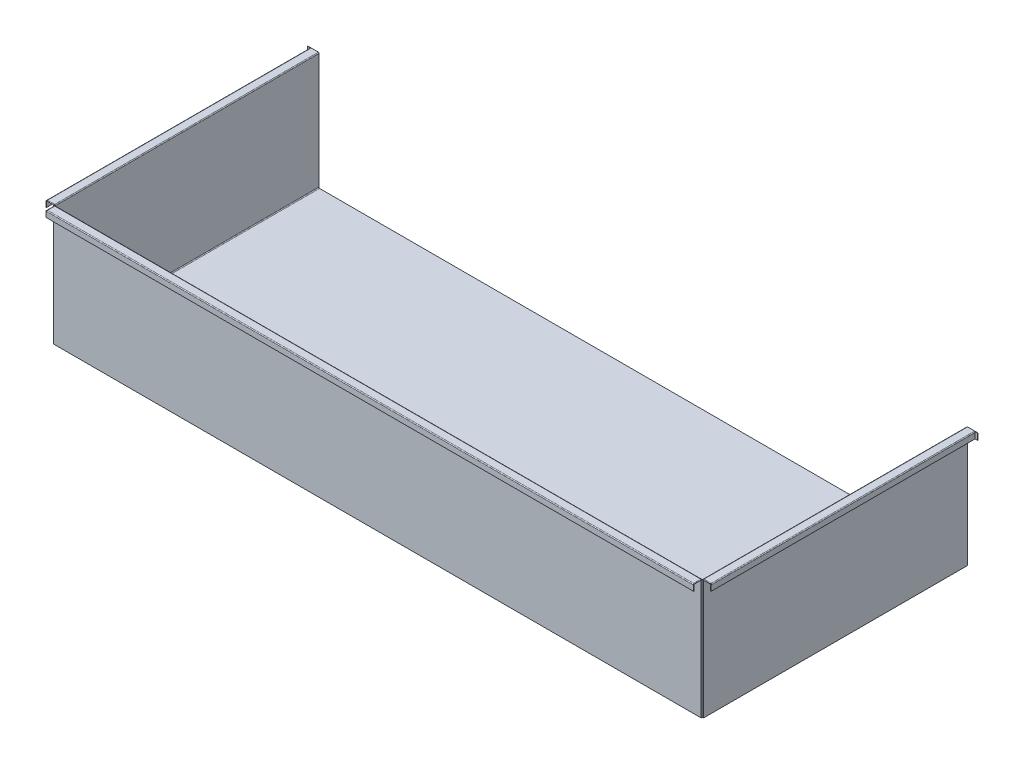
from build123d import *

# Parameters (mm, degrees)
BOSS_EXTRUDE1_DEPTH = 336.55
SKETCH2_W           = 14.2875
SKETCH2_H           = 7.9375
BOSS_EXTRUDE2_DEPTH = 0.508
BOSS_EXTRUDE6_DEPTH = 412.7627
FILLET1_R           = 1.016
FILLET2_R           = 1.016
FILLET3_R           = 1.016
FILLET4_R           = 1.016
FILLET5_R           = 1.016


with BuildPart() as part:
    # Sketch1 → Boss-Extrude1 (new body)
    with BuildSketch(Plane.XY):
        Polygon((-412.75, 0), (412.75, 0), (412.75, 149.225), (423.8625, 149.225), (423.8625, 141.2875), (423.3545, 141.2875), (423.3545, 148.717), (414.3375, 148.717), (414.3375, -3.175), (-414.3375, -3.175), (-414.3375, 148.717), (-423.3545, 148.717), (-423.3545, 141.2875), (-423.8625, 141.2875), (-423.8625, 149.225), (-412.75, 149.225), align=None)
    extrude(amount=BOSS_EXTRUDE1_DEPTH)

    # Sketch2 → Boss-Extrude2 (add)
    with BuildSketch(Plane(origin=(0, 0, 0), x_dir=(-1, 0, 0), z_dir=(0, 0, -1))):
        with Locations((-419.89375, 145.25625)):
            Rectangle(SKETCH2_W, SKETCH2_H)
        with Locations((419.89375, 145.25625)):
            Rectangle(SKETCH2_W, SKETCH2_H)
    extrude(amount=BOSS_EXTRUDE2_DEPTH)

    # Sketch3 → Boss-Extrude6 (add, symmetric)
    with BuildSketch(Plane(origin=(0, 0, 0), x_dir=(0, 0, -1), z_dir=(1, 0, 0))):
        Polygon((-336.55, -3.175), (-336.55, 149.225), (-347.6625, 149.225), (-347.6625, 141.2875), (-347.1545, 141.2875), (-347.1545, 148.717), (-338.1375, 148.717), (-338.1375, -3.175), align=None)
    extrude(amount=BOSS_EXTRUDE6_DEPTH, both=True)

    # Fillet1
    fillet1_edges = [part.edges().sort_by_distance(p)[0] for p in [
        (412.75, 74.6125, 336.55),
    ]]
    fillet(fillet1_edges, radius=FILLET1_R)

    # Fillet2
    fillet2_edges = [part.edges().sort_by_distance(p)[0] for p in [
        (412.7627, 73.025, 336.55),
    ]]
    fillet(fillet2_edges, radius=FILLET2_R)

    # Fillet3
    fillet3_edges = [part.edges().sort_by_distance(p)[0] for p in [
        (-412.75, 74.6125, 336.55),
        (-412.7627, 73.025, 336.55),
    ]]
    fillet(fillet3_edges, radius=FILLET3_R)

    # Fillet4
    fillet4_edges = [part.edges().sort_by_distance(p)[0] for p in [
        (0, 0, 336.55),
        (412.75, 0, 167.767),
        (412.45242049, 0, 336.25242049),
        (-412.75, 0, 167.767),
        (-412.45242049, 0, 336.25242049),
    ]]
    fillet(fillet4_edges, radius=FILLET4_R)

    # Fillet5
    # the kernel refuses this fillet: 1.016 mm, written as the material it takes off along each edge
    with BuildSketch(Plane(origin=(413.7787, 149.225, 336.55), x_dir=(0, 0, -1), z_dir=(1, 0, 0)), Plane(origin=(-426.4025, 149.225, 336.55), x_dir=(0, 0, -1), z_dir=(1, 0, 0))) as fillet5_piece_1:
        with BuildLine():
            CenterArc((FILLET5_R, -FILLET5_R), FILLET5_R, 90, 90)
            Line((0, -FILLET5_R), (0, 0))
            Line((0, 0), (FILLET5_R, 0))
        make_face()
    fillet5_piece_1_solid = extrude(amount=12.6238, mode=Mode.PRIVATE)
    with BuildSketch(Plane(origin=(413.7787, 149.225, 337.566), x_dir=(0, 0, -1), z_dir=(1, 0, 0))) as fillet5_piece_2:
        with BuildLine():
            CenterArc((1.016 + FILLET5_R, -FILLET5_R), FILLET5_R, 90, 90)
            Line((1.016, -FILLET5_R), (1.016, 0))
            Line((1.016, 0), (1.016 + FILLET5_R, 0))
        make_face()
    fillet5_piece_2_solid = revolve(axis=Axis((413.7787, 149.225, 337.566), (0, 1, 0)), revolution_arc=90, mode=Mode.PRIVATE)
    with BuildSketch(Plane(origin=(-413.7787, 149.225, 337.566), x_dir=(1, 0, 0), z_dir=(0, 0, 1))) as fillet5_piece_3:
        with BuildLine():
            CenterArc((1.016 + FILLET5_R, -FILLET5_R), FILLET5_R, 90, 90)
            Line((1.016, -FILLET5_R), (1.016, 0))
            Line((1.016, 0), (1.016 + FILLET5_R, 0))
        make_face()
    fillet5_piece_3_solid = revolve(axis=Axis((-413.7787, 149.225, 337.566), (0, 1, 0)), revolution_arc=90, mode=Mode.PRIVATE)
    with BuildSketch(Plane(origin=(-412.75, 149.225, -3.048), x_dir=(0, -1, 0), z_dir=(0, 0, 1))) as fillet5_piece_4:
        with BuildLine():
            CenterArc((FILLET5_R, -FILLET5_R), FILLET5_R, 90, 90)
            Line((0, -FILLET5_R), (0, 0))
            Line((0, 0), (FILLET5_R, 0))
        make_face()
    fillet5_piece_4_solid = extrude(amount=338.582, mode=Mode.PRIVATE)
    with BuildSketch(Plane(origin=(-411.734, 149.225, 335.534), x_dir=(0, 0, 1), z_dir=(1, 0, 0))) as fillet5_piece_5:
        with BuildLine():
            CenterArc((1.016 + FILLET5_R, FILLET5_R), FILLET5_R, 180, 90)
            Line((1.016 + FILLET5_R, 0), (1.016, 0))
            Line((1.016, 0), (1.016, FILLET5_R))
        make_face()
    fillet5_piece_5_solid = revolve(axis=Axis((-411.734, 149.225, 335.534), (0, -1, 0)), revolution_arc=90, mode=Mode.PRIVATE)
    with BuildSketch(Plane(origin=(-411.734, 149.225, 336.55), x_dir=(0, 0, 1), z_dir=(1, 0, 0))) as fillet5_piece_6:
        with BuildLine():
            CenterArc((FILLET5_R, FILLET5_R), FILLET5_R, 180, 90)
            Line((0, FILLET5_R), (0, 0))
            Line((0, 0), (FILLET5_R, 0))
        make_face()
    fillet5_piece_6_solid = extrude(amount=823.468, mode=Mode.PRIVATE)
    with BuildSketch(Plane(origin=(411.734, 149.225, 335.534), x_dir=(1, 0, 0), z_dir=(0, 0, -1))) as fillet5_piece_7:
        with BuildLine():
            CenterArc((1.016 + FILLET5_R, FILLET5_R), FILLET5_R, 180, 90)
            Line((1.016, FILLET5_R), (1.016, 0))
            Line((1.016, 0), (1.016 + FILLET5_R, 0))
        make_face()
    fillet5_piece_7_solid = revolve(axis=Axis((411.734, 149.225, 335.534), (0, -1, 0)), revolution_arc=90, mode=Mode.PRIVATE)
    with BuildSketch(Plane(origin=(412.7627, 149.225, 337.566), x_dir=(-1, 0, 0), z_dir=(0, 0, 1))) as fillet5_piece_8:
        with BuildLine():
            CenterArc((FILLET5_R, FILLET5_R), FILLET5_R, 180, 90)
            Line((0, FILLET5_R), (0, 0))
            Line((0, 0), (FILLET5_R, 0))
        make_face()
    fillet5_piece_8_solid = extrude(amount=12.6365, mode=Mode.PRIVATE)
    with BuildSketch(Plane(origin=(-412.7627, 149.225, 337.566), x_dir=(1, 0, 0), z_dir=(0, 0, 1))) as fillet5_piece_9:
        with BuildLine():
            CenterArc((FILLET5_R, -FILLET5_R), FILLET5_R, 90, 90)
            Line((0, -FILLET5_R), (0, 0))
            Line((0, 0), (FILLET5_R, 0))
        make_face()
    fillet5_piece_9_solid = extrude(amount=12.6365, mode=Mode.PRIVATE)
    with BuildSketch(Plane(origin=(-415.3027, 149.225, 347.6625), x_dir=(0, 0, -1), z_dir=(1, 0, 0))) as fillet5_piece_10:
        with BuildLine():
            CenterArc((FILLET5_R, -FILLET5_R), FILLET5_R, 90, 90)
            Line((0, -FILLET5_R), (0, 0))
            Line((0, 0), (FILLET5_R, 0))
        make_face()
    fillet5_piece_10_solid = extrude(amount=830.6054, mode=Mode.PRIVATE)
    with BuildSketch(Plane(origin=(-423.8625, 149.225, 0), x_dir=(1, 0, 0), z_dir=(0, 0, 1))) as fillet5_piece_11:
        with BuildLine():
            CenterArc((FILLET5_R, -FILLET5_R), FILLET5_R, 90, 90)
            Line((0, -FILLET5_R), (0, 0))
            Line((0, 0), (FILLET5_R, 0))
        make_face()
    fillet5_piece_11_solid = extrude(amount=339.09, mode=Mode.PRIVATE)
    with BuildSketch(Plane(origin=(412.75, 149.225, 335.534), x_dir=(1, 0, 0), z_dir=(0, 0, -1))) as fillet5_piece_12:
        with BuildLine():
            CenterArc((FILLET5_R, FILLET5_R), FILLET5_R, 180, 90)
            Line((0, FILLET5_R), (0, 0))
            Line((0, 0), (FILLET5_R, 0))
        make_face()
    fillet5_piece_12_solid = extrude(amount=338.582, mode=Mode.PRIVATE)
    with BuildSketch(Plane(origin=(423.8625, 149.225, 0), x_dir=(-1, 0, 0), z_dir=(0, 0, 1))) as fillet5_piece_13:
        with BuildLine():
            CenterArc((FILLET5_R, FILLET5_R), FILLET5_R, 180, 90)
            Line((0, FILLET5_R), (0, 0))
            Line((0, 0), (FILLET5_R, 0))
        make_face()
    fillet5_piece_13_solid = extrude(amount=339.09, mode=Mode.PRIVATE)
    add([fillet5_piece_1_solid, fillet5_piece_2_solid, fillet5_piece_3_solid, fillet5_piece_4_solid, fillet5_piece_5_solid, fillet5_piece_6_solid, fillet5_piece_7_solid, fillet5_piece_8_solid, fillet5_piece_9_solid, fillet5_piece_10_solid, fillet5_piece_11_solid, fillet5_piece_12_solid, fillet5_piece_13_solid], mode=Mode.SUBTRACT)


solid = part.part
